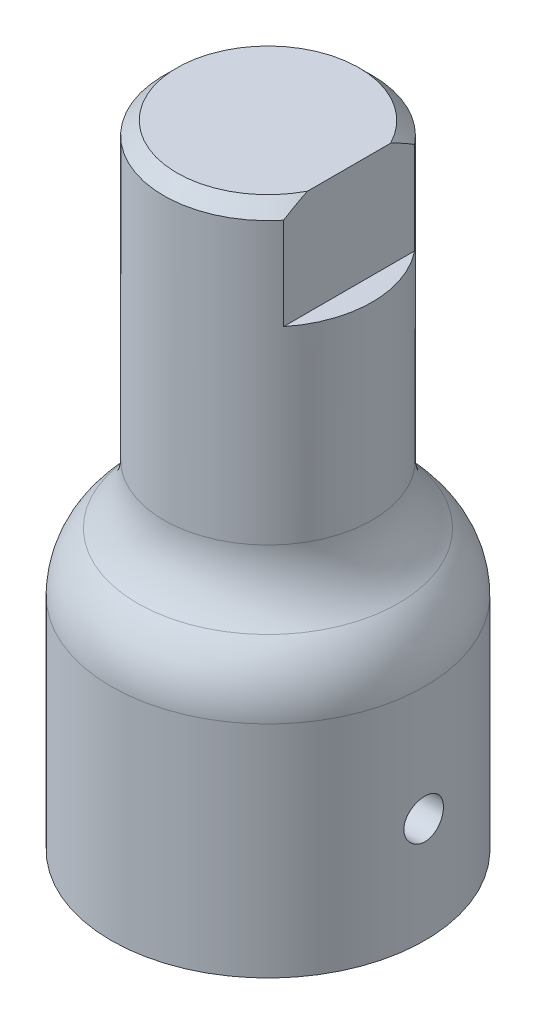
from build123d import *

# Parameters (mm, degrees)
SKETCH1_R           = 6.2865
BASE_EXTRUDE_DEPTH  = 38.1
SKETCH3_R           = 9.4615
BOSS_EXTRUDE1_DEPTH = 15.875
CUT_EXTRUDE1_DEPTH  = 12.7
FILLET1_R           = 4.7625
FILLET2_R           = 4.7625
SKETCH5_R           = 1.190625
CUT_EXTRUDE2_DEPTH  = 42.798101456
CUT_EXTRUDE3_START  = -6.35
CUT_EXTRUDE3_DEPTH  = 6.35
CHAMFER1_SIZE       = 0.79375


with BuildPart() as part:
    # Sketch1 → Base-Extrude (new body)
    with BuildSketch(Plane(origin=(0, 0, 0), x_dir=(-1, 0, 0), z_dir=(0, 1, 0))):
        with Locations(Location((0, 0, 0), (0, 0, 270))):
            Circle(SKETCH1_R)
    extrude(amount=BASE_EXTRUDE_DEPTH)

    # Sketch3 → Boss-Extrude1 (add)
    with BuildSketch(Plane(origin=(0, 0, 0), x_dir=(-1, 0, 0), z_dir=(0, 1, 0))):
        with Locations(Location((0, 0, 0), (0, 0, 90))):
            Circle(SKETCH3_R)
    extrude(amount=BOSS_EXTRUDE1_DEPTH)

    # Sketch4 → Cut-Extrude1 (cut)
    with BuildSketch(Plane(origin=(0, 0, 0), x_dir=(-1, 0, 0), z_dir=(0, 1, 0))):
        with BuildLine():
            Line((-4.8895, 4.247860491), (-4.8895, -4.247860491))
            ThreePointArc((-4.8895, -4.247860491), (6.477, 0), (-4.8895, 4.247860491))
        make_face()
    extrude(amount=CUT_EXTRUDE1_DEPTH, mode=Mode.SUBTRACT)

    # Fillet1
    # the kernel refuses this fillet: 4.7625 mm, written as the material it adds along each edge
    with BuildSketch(Plane(origin=(0, 15.875, 0), x_dir=(0, 0, -1), z_dir=(-1, 0, 0))) as fillet1_piece_1:
        with BuildLine():
            CenterArc((11.049, -4.490128061), FILLET1_R, 109.471220634, 70.528779366)
            Line((6.2865, -4.490128061), (6.19125, -4.490128061))
            Line((6.19125, -4.490128061), (6.19125, 0))
            Line((6.19125, 0), (6.2865, 0.09525))
            ThreePointArc((6.2865, 0.09525), (7.874, 0.09525), (9.42975, 0.089802561))
            Line((9.42975, 0.089802561), (9.4615, 0))
        make_face()
    revolve(axis=Axis((0, 15.875, 0), (0, -1, 0)))

    # Fillet2
    fillet2_edges = [part.edges().sort_by_distance(p)[0] for p in [
        (9.4615, 15.875, 0),
    ]]
    fillet(fillet2_edges, radius=FILLET2_R)

    # Sketch5 → Cut-Extrude2 (cut, through all)
    with BuildSketch(Plane.ZY.offset(-4.8895)):
        with Locations((0, 6.35)):
            Circle(SKETCH5_R)
    extrude(amount=-CUT_EXTRUDE2_DEPTH, mode=Mode.SUBTRACT)

    # Sketch7 → Cut-Extrude3 (cut)
    with BuildSketch(Plane(origin=(0, 38.1, 0), x_dir=(-1, 0, 0), z_dir=(0, 1, 0)).offset(CUT_EXTRUDE3_START)):
        with BuildLine():
            Line((-4.8895, 3.951312693), (-4.8895, -3.951312693))
            ThreePointArc((-4.8895, -3.951312693), (-6.2865, 0), (-4.8895, 3.951312693))
        make_face()
    extrude(amount=CUT_EXTRUDE3_DEPTH, mode=Mode.SUBTRACT)

    # Chamfer1
    chamfer1_edges = [part.edges().sort_by_distance(p)[0] for p in [
        (-5.67274226, 38.1, 2.70925774),
    ]]
    chamfer(chamfer1_edges, length=CHAMFER1_SIZE)


solid = part.part
